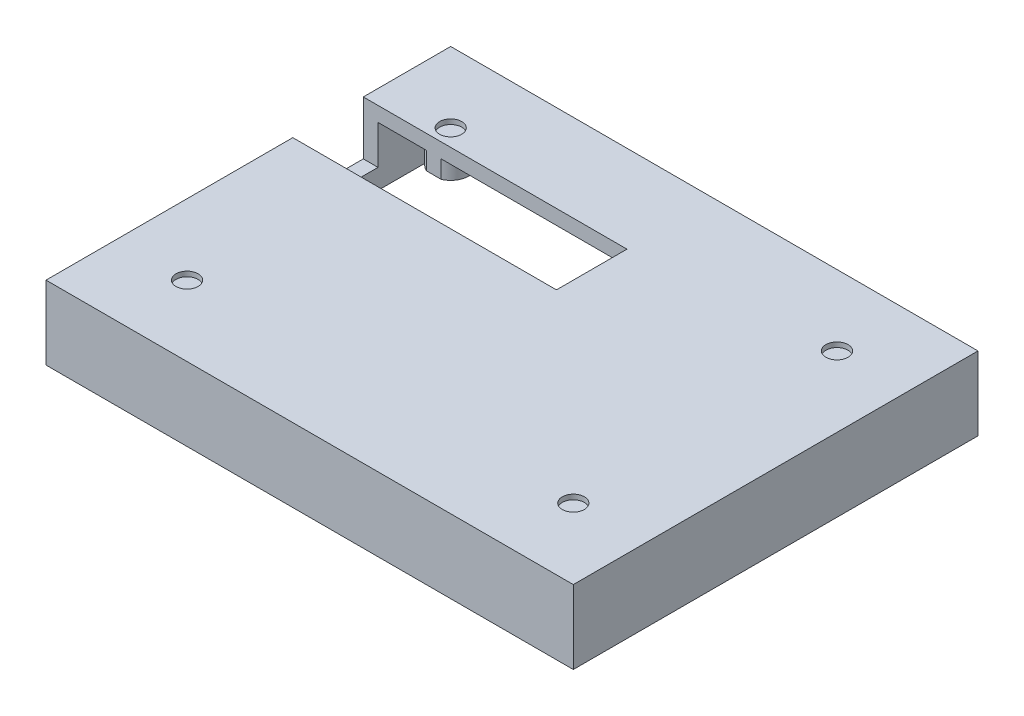
from build123d import *

# Parameters (mm, degrees)
SKETCH1_W           = 86
SKETCH1_H           = 66
BOSS_EXTRUDE1_DEPTH = 12
SKETCH2_W           = 81.2
SKETCH2_H           = 61.2
CUT_EXTRUDE1_DEPTH  = 9.6
SKETCH3_W           = 52
SKETCH3_H           = 36
CUT_EXTRUDE2_DEPTH  = 1.6
SKETCH4_R           = 3
BOSS_EXTRUDE2_DEPTH = 4.5
SKETCH5_R           = 1.8
CUT_EXTRUDE3_DEPTH  = 4.5
SKETCH6_R           = 1.25
SKETCH6_W           = 11.5
SKETCH6_H           = 9.5
CUT_EXTRUDE4_DEPTH  = 50


with BuildPart() as part:
    # Sketch1 → Boss-Extrude1 (new body)
    with BuildSketch(Plane(origin=(0, 0, 0), x_dir=(1, 0, 0), z_dir=(0, 1, 0))):
        Rectangle(SKETCH1_W, SKETCH1_H)
    extrude(amount=BOSS_EXTRUDE1_DEPTH)

    # Sketch2 → Cut-Extrude1 (cut)
    with BuildSketch(Plane.XZ):
        Rectangle(SKETCH2_W, SKETCH2_H)
    extrude(amount=-CUT_EXTRUDE1_DEPTH, mode=Mode.SUBTRACT)

    # Sketch3 → Cut-Extrude2 (cut)
    with BuildSketch(Plane.XZ.offset(-9.6)):
        Rectangle(SKETCH3_W, SKETCH3_H)
    extrude(amount=-CUT_EXTRUDE2_DEPTH, mode=Mode.SUBTRACT)

    # Sketch4 → Boss-Extrude2 (add)
    with BuildSketch(Plane.XZ.offset(-11.2)):
        with Locations((-31.5, -21.5)):
            Circle(SKETCH4_R)
        with Locations((31.5, -21.5)):
            Circle(SKETCH4_R)
        with Locations((-31.5, 21.5)):
            Circle(SKETCH4_R)
        with Locations((31.5, 21.5)):
            Circle(SKETCH4_R)
    extrude(amount=BOSS_EXTRUDE2_DEPTH)

    # Sketch5 → Cut-Extrude3 (cut)
    with BuildSketch(Plane.XZ.offset(-11.2)):
        with Locations((-31.5, -21.5)):
            Circle(SKETCH5_R)
        with Locations((31.5, -21.5)):
            Circle(SKETCH5_R)
        with Locations((-31.5, 21.5)):
            Circle(SKETCH5_R)
        with Locations((31.5, 21.5)):
            Circle(SKETCH5_R)
    extrude(amount=-CUT_EXTRUDE3_DEPTH, mode=Mode.SUBTRACT)

    # Sketch6 → Cut-Extrude4 (cut)
    with BuildSketch(Plane(origin=(0, 0, 0), x_dir=(0, 0, -1), z_dir=(1, 0, 0))):
        with Locations((-5, 8)):
            Circle(SKETCH6_R)
        with Locations((13, 8)):
            Rectangle(SKETCH6_W, SKETCH6_H)
    extrude(amount=-CUT_EXTRUDE4_DEPTH, mode=Mode.SUBTRACT)


solid = part.part
